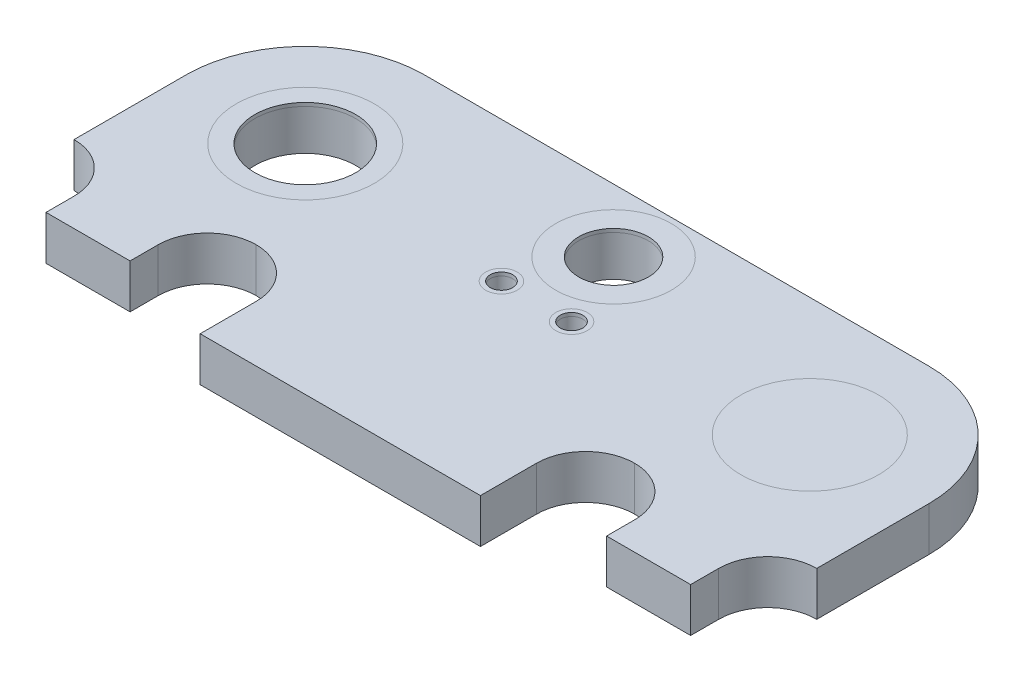
from build123d import *

# Parameters (mm, degrees)
SKETCH2_R           = 0.4064
SKETCH2_R_2         = 1.26365
SKETCH2_R_3         = 1.8288
BOSS_EXTRUDE1_DEPTH = 1.6002
SKETCH5_R           = 2.5019
SKETCH5_R_2         = 2.0955
SKETCH5_R_3         = 0.5715
CUT_EXTRUDE1_DEPTH  = 0.127
BOSS_EXTRUDE2_REACH = 17.678
SKETCH6_R           = 2.5019
SKETCH6_R_2         = 2.0955
SKETCH6_R_3         = 1.26365
SKETCH6_R_4         = 0.5715
SKETCH6_R_5         = 0.4064
SKETCH6_R_6         = 1.8288
FILLET1_R           = 1.778


with BuildPart() as part:
    # Sketch2 → Boss-Extrude1 (new body)
    with BuildSketch(Plane(origin=(0, 0, 0), x_dir=(1, 0, 0), z_dir=(0, 1, 0))):
        with BuildLine():
            Line((-9.144, 4.318), (9.144, 4.318))
            ThreePointArc((9.144, 4.318), (12.197287081, 3.053287081), (13.462, 0))
            Line((13.462, 0), (13.462, -4.064))
            Line((13.462, -4.064), (11.684, -4.064))
            Line((11.684, -4.064), (11.684, -6.858))
            Line((11.684, -6.858), (8.636, -6.858))
            Line((8.636, -6.858), (8.636, -4.064))
            Line((8.636, -4.064), (5.08, -4.064))
            Line((5.08, -4.064), (5.08, -7.874))
            Line((5.08, -7.874), (-5.08, -7.874))
            Line((-5.08, -7.874), (-5.08, -4.064))
            Line((-5.08, -4.064), (-8.636, -4.064))
            Line((-8.636, -4.064), (-8.636, -6.858))
            Line((-8.636, -6.858), (-11.684, -6.858))
            Line((-11.684, -6.858), (-11.684, -4.064))
            Line((-11.684, -4.064), (-13.462, -4.064))
            Line((-13.462, -4.064), (-13.462, 0))
            ThreePointArc((-13.462, 0), (-12.197287081, 3.053287081), (-9.144, 4.318))
        make_face()
        with Locations(Location((-1.27, -0.762, 0), (0, 0, 270))):
            Circle(SKETCH2_R, mode=Mode.SUBTRACT)
        with Locations(Location((0, 2.032, 0), (0, 0, 270))):
            Circle(SKETCH2_R_2, mode=Mode.SUBTRACT)
        with Locations(Location((1.27, -0.762, 0), (0, 0, 270))):
            Circle(SKETCH2_R, mode=Mode.SUBTRACT)
        with Locations(Location((-9.144, 0, 0), (0, 0, 270))):
            Circle(SKETCH2_R_3, mode=Mode.SUBTRACT)
    extrude(amount=-BOSS_EXTRUDE1_DEPTH)

    # Sketch5 → Cut-Extrude1 (cut)
    with BuildSketch(Plane(origin=(0, 0, 0), x_dir=(1, 0, 0), z_dir=(0, 1, 0))):
        with Locations(Location((-9.144, 0, 0), (0, 0, 270))):
            Circle(SKETCH5_R)
        with Locations(Location((9.144, 0, 0), (0, 0, 270))):
            Circle(SKETCH5_R)
        with Locations(Location((0, 2.032, 0), (0, 0, 270))):
            Circle(SKETCH5_R_2)
        with Locations(Location((-1.27, -0.762, 0), (0, 0, 270))):
            Circle(SKETCH5_R_3)
        with Locations(Location((1.27, -0.762, 0), (0, 0, 270))):
            Circle(SKETCH5_R_3)
    extrude(amount=-CUT_EXTRUDE1_DEPTH, mode=Mode.SUBTRACT)


with BuildPart() as body_2:

    # Sketch6 → Boss-Extrude2 (new, up to next)
    with BuildSketch(Plane(origin=(0, 0, 0), x_dir=(1, 0, 0), z_dir=(0, 1, 0)), mode=Mode.PRIVATE) as boss_extrude2_sk1:
        with Locations(Location((9.144, 0, 0), (0, 0, 270))):
            Circle(SKETCH6_R)
    boss_extrude2_tool1 = extrude(boss_extrude2_sk1.sketch, amount=-BOSS_EXTRUDE2_REACH, mode=Mode.PRIVATE) - part.part
    # Sketch6 → Boss-Extrude2 (new, up to next)
    with BuildSketch(Plane(origin=(0, 0, 0), x_dir=(1, 0, 0), z_dir=(0, 1, 0)), mode=Mode.PRIVATE) as boss_extrude2_sk2:
        with Locations(Location((0, 2.032, 0), (0, 0, 270))):
            Circle(SKETCH6_R_2)
        with Locations(Location((0, 2.032, 0), (0, 0, 270))):
            Circle(SKETCH6_R_3, mode=Mode.SUBTRACT)
    boss_extrude2_tool2 = extrude(boss_extrude2_sk2.sketch, amount=-BOSS_EXTRUDE2_REACH, mode=Mode.PRIVATE) - part.part
    # Sketch6 → Boss-Extrude2 (new, up to next)
    with BuildSketch(Plane(origin=(0, 0, 0), x_dir=(1, 0, 0), z_dir=(0, 1, 0)), mode=Mode.PRIVATE) as boss_extrude2_sk3:
        with Locations(Location((-1.27, -0.762, 0), (0, 0, 270))):
            Circle(SKETCH6_R_4)
        with Locations(Location((-1.27, -0.762, 0), (0, 0, 270))):
            Circle(SKETCH6_R_5, mode=Mode.SUBTRACT)
    boss_extrude2_tool3 = extrude(boss_extrude2_sk3.sketch, amount=-BOSS_EXTRUDE2_REACH, mode=Mode.PRIVATE) - part.part
    # Sketch6 → Boss-Extrude2 (new, up to next)
    with BuildSketch(Plane(origin=(0, 0, 0), x_dir=(1, 0, 0), z_dir=(0, 1, 0)), mode=Mode.PRIVATE) as boss_extrude2_sk4:
        with Locations(Location((1.27, -0.762, 0), (0, 0, 270))):
            Circle(SKETCH6_R_4)
        with Locations(Location((1.27, -0.762, 0), (0, 0, 270))):
            Circle(SKETCH6_R_5, mode=Mode.SUBTRACT)
    boss_extrude2_tool4 = extrude(boss_extrude2_sk4.sketch, amount=-BOSS_EXTRUDE2_REACH, mode=Mode.PRIVATE) - part.part
    # Sketch6 → Boss-Extrude2 (new, up to next)
    with BuildSketch(Plane(origin=(0, 0, 0), x_dir=(1, 0, 0), z_dir=(0, 1, 0)), mode=Mode.PRIVATE) as boss_extrude2_sk5:
        with Locations(Location((-9.144, 0, 0), (0, 0, 270))):
            Circle(SKETCH6_R)
        with Locations(Location((-9.144, 0, 0), (0, 0, 270))):
            Circle(SKETCH6_R_6, mode=Mode.SUBTRACT)
    boss_extrude2_tool5 = extrude(boss_extrude2_sk5.sketch, amount=-BOSS_EXTRUDE2_REACH, mode=Mode.PRIVATE) - part.part
    add(boss_extrude2_tool1.solids().sort_by_distance((9.144, 0, 0))[0])
    add(boss_extrude2_tool2.solids().sort_by_distance((0, 0, -4.06823))[0])
    add(boss_extrude2_tool3.solids().sort_by_distance((-1.27, 0, 0.206664))[0])
    add(boss_extrude2_tool4.solids().sort_by_distance((1.27, 0, 0.206664))[0])
    add(boss_extrude2_tool5.solids().sort_by_distance((-9.144, 0, -2.431136))[0])


with BuildPart() as part_1:
    add(part.part)

    # Fillet1
    fillet1_edges = [part_1.edges().sort_by_distance(p)[0] for p in [
        (5.08, -0.8001, 4.064),
        (8.636, -0.8001, 4.064),
        (-8.636, -0.8001, 4.064),
        (-11.684, -0.8001, 4.064),
        (-5.08, -0.8001, 4.064),
        (11.684, -0.8001, 4.064),
    ]]
    fillet(fillet1_edges, radius=FILLET1_R - 0.0001)  # a hair under: the kernel refuses the full size


solid = Compound([body_2.part, part_1.part])
